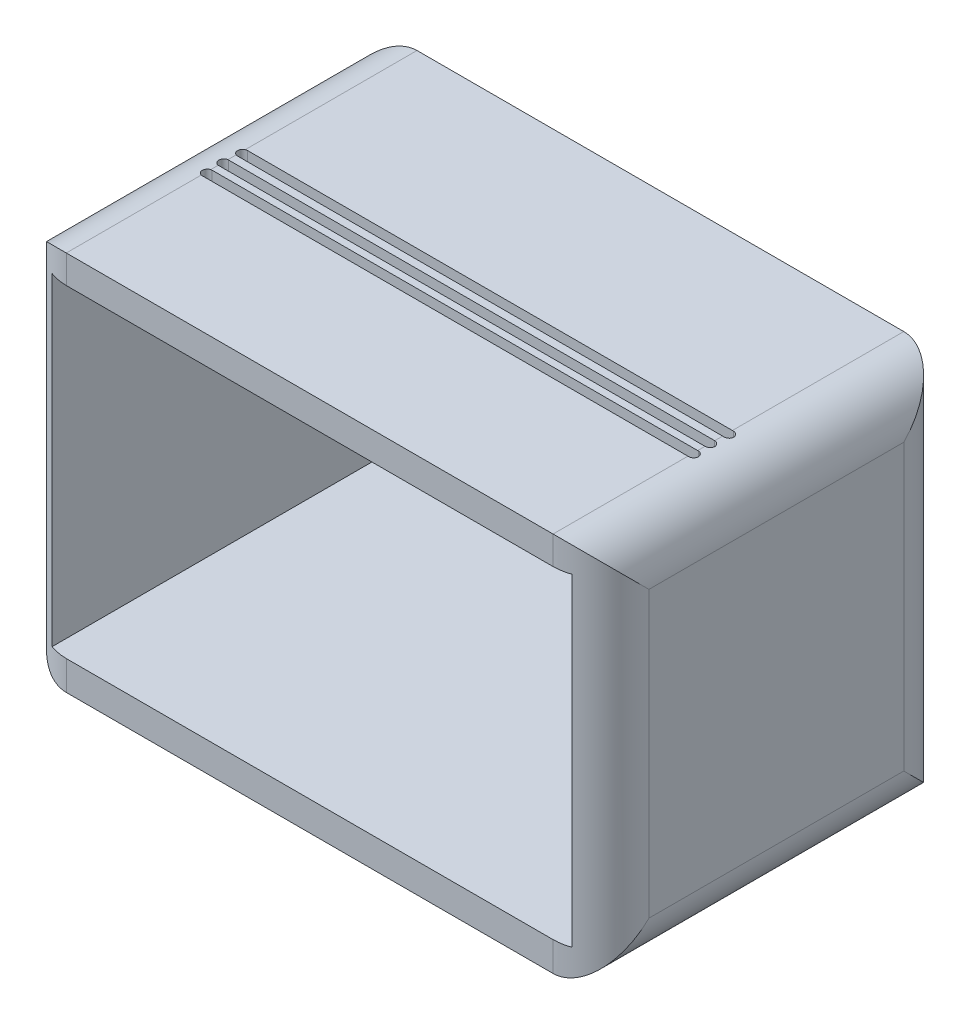
from build123d import *

# Parameters (mm, degrees)
IZIM1_W                     = 121.550964813
IZIM1_H                     = 79.400227015
IZIM1_W_2                   = 108.562656073
IZIM1_H_2                   = 67.392167991
Y_KSEKLIK_EKSTR_ZYON1_DEPTH = 73.164910278
IZIM2_W                     = 108.665778405
IZIM2_H                     = 2.839609685
Y_KSEKLIK_EKSTR_ZYON3_DEPTH = 67.31
IZIM4_W                     = 43.769026383
IZIM4_H                     = 34.779664875
KES_EKSTR_ZYON3_DEPTH       = 51.308
RADYUS1_R                   = 10
RADYUS2_R                   = 10
KES_EKSTR_ZYON6_DEPTH       = 25.4
Y_KSEKLIK_EKSTR_ZYON4_DEPTH = 4.572


with BuildPart() as part:
    # Çizim1 → Yükseklik-Ekstrüzyon1 (new body)
    with BuildSketch(Plane.XY):
        with Locations((3.983010787, 3.063280364)):
            Rectangle(IZIM1_W, IZIM1_H)
        with Locations((3.860479571, 3.185811577)):
            Rectangle(IZIM1_W_2, IZIM1_H_2, mode=Mode.SUBTRACT)
    extrude(amount=Y_KSEKLIK_EKSTR_ZYON1_DEPTH)

    # Çizim2 → Yükseklik-Ekstrüzyon3 (add)
    with BuildSketch(Plane(origin=(0, -30.510272418, 0), x_dir=(1, 0, 0), z_dir=(0, 1, 0))):
        with Locations((3.70835341, -1.557090266)):
            Rectangle(IZIM2_W, IZIM2_H)
    extrude(amount=Y_KSEKLIK_EKSTR_ZYON3_DEPTH)

    # Çizim4 → Kes-Ekstrüzyon3 (cut)
    with BuildSketch(Plane(origin=(0, 0, 0.137285424), x_dir=(-1, 0, 0), z_dir=(0, 0, -1))):
        with Locations((-2.08713858, 8.765719608)):
            Rectangle(IZIM4_W, IZIM4_H)
    extrude(amount=-KES_EKSTR_ZYON3_DEPTH, mode=Mode.SUBTRACT)

    # Radyus1
    # the kernel refuses this fillet: 10 mm, written as the material it takes off along each edge
    with BuildSketch(Plane(origin=(64.758493193, -36.636833144, -25), x_dir=(0, 1, 0), z_dir=(0, 0, 1)), Plane(origin=(64.758493193, 42.763393871, -25), x_dir=(-1, 0, 0), z_dir=(0, 0, 1))) as radyus1_piece_1:
        with BuildLine():
            CenterArc((RADYUS1_R, RADYUS1_R), RADYUS1_R, 180, 90)
            Line((0, RADYUS1_R), (0, 0))
            Line((0, 0), (RADYUS1_R, 0))
        make_face()
    extrude(amount=123.164910278, mode=Mode.SUBTRACT)
    with BuildSketch(Plane(origin=(64.758493193, 67.763393871, 73.164910278), x_dir=(0, 0, -1), z_dir=(0, -1, 0))) as radyus1_piece_2:
        with BuildLine():
            CenterArc((RADYUS1_R, -RADYUS1_R), RADYUS1_R, 90, 90)
            Line((0, -RADYUS1_R), (0, 0))
            Line((0, 0), (RADYUS1_R, 0))
        make_face()
    extrude(amount=129.400227015, mode=Mode.SUBTRACT)
    with BuildSketch(Plane(origin=(64.758493193, 67.763393871, 0), x_dir=(0, 0, 1), z_dir=(0, -1, 0))) as radyus1_piece_3:
        with BuildLine():
            CenterArc((RADYUS1_R, RADYUS1_R), RADYUS1_R, 180, 90)
            Line((0, RADYUS1_R), (0, 0))
            Line((0, 0), (RADYUS1_R, 0))
        make_face()
    extrude(amount=129.400227015, mode=Mode.SUBTRACT)

    # Radyus2
    # the kernel refuses this fillet: 10 mm, written as the material it takes off along each edge
    with BuildSketch(Plane(origin=(-56.79247162, 42.763393871, -25), x_dir=(1, 0, 0), z_dir=(0, 0, 1)), Plane(origin=(-56.79247162, -36.636833144, -25), x_dir=(0, 1, 0), z_dir=(0, 0, 1))) as radyus2_piece_1:
        with BuildLine():
            CenterArc((RADYUS2_R, -RADYUS2_R), RADYUS2_R, 90, 90)
            Line((0, -RADYUS2_R), (0, 0))
            Line((0, 0), (RADYUS2_R, 0))
        make_face()
    extrude(amount=123.164910278, mode=Mode.SUBTRACT)
    with BuildSketch(Plane(origin=(-56.79247162, -61.636833144, 73.164910278), x_dir=(1, 0, 0), z_dir=(0, 1, 0))) as radyus2_piece_2:
        with BuildLine():
            CenterArc((RADYUS2_R, RADYUS2_R), RADYUS2_R, 180, 90)
            Line((0, RADYUS2_R), (0, 0))
            Line((0, 0), (RADYUS2_R, 0))
        make_face()
    extrude(amount=129.400227015, mode=Mode.SUBTRACT)
    with BuildSketch(Plane(origin=(-56.79247162, -61.636833144, 0), x_dir=(1, 0, 0), z_dir=(0, 1, 0))) as radyus2_piece_3:
        with BuildLine():
            CenterArc((RADYUS2_R, -RADYUS2_R), RADYUS2_R, 90, 90)
            Line((0, -RADYUS2_R), (0, 0))
            Line((0, 0), (RADYUS2_R, 0))
        make_face()
    extrude(amount=129.400227015, mode=Mode.SUBTRACT)

    # Çizim5 → Kes-Ekstrüzyon6 (cut)
    with BuildSketch(Plane(origin=(0, 42.763393871, 0), x_dir=(1, 0, 0), z_dir=(0, 1, 0))):
        with BuildLine():
            Line((-46.423230595, -35.751971692), (55.012749139, -35.751971692))
            ThreePointArc((55.012749139, -35.751971692), (56.029772925, -36.768995478), (55.012749139, -37.786019263))
            Line((55.012749139, -37.786019263), (-46.423230595, -37.786019263))
            ThreePointArc((-46.423230595, -37.786019263), (-47.44025438, -36.768995478), (-46.423230595, -35.751971692))
        make_face()
        with BuildLine():
            Line((-46.550358568, -42.998266165), (54.885621166, -42.998266165))
            ThreePointArc((54.885621166, -42.998266165), (55.902644952, -44.015289951), (54.885621166, -45.032313737))
            Line((54.885621166, -45.032313737), (-46.550358568, -45.032313737))
            ThreePointArc((-46.550358568, -45.032313737), (-47.567382354, -44.015289951), (-46.550358568, -42.998266165))
        make_face()
        with BuildLine():
            Line((-46.677486541, -39.438682915), (54.758493193, -39.438682915))
            ThreePointArc((54.758493193, -39.438682915), (55.775516978, -40.455706701), (54.758493193, -41.472730487))
            Line((54.758493193, -41.472730487), (-46.677486541, -41.472730487))
            ThreePointArc((-46.677486541, -41.472730487), (-47.694510327, -40.455706701), (-46.677486541, -39.438682915))
        make_face()
    extrude(amount=-KES_EKSTR_ZYON6_DEPTH, mode=Mode.SUBTRACT)

    # Çizim6 → Yükseklik-Ekstrüzyon4 (add)
    with BuildSketch(Plane(origin=(0, -36.636833144, 0), x_dir=(-1, 0, 0), z_dir=(0, -1, 0))):
        with BuildLine():
            Line((-46.87100271, -4.227005014), (-46.87100271, -64.014742354))
            ThreePointArc((-46.87100271, -64.014742354), (-49.504404567, -66.64814421), (-52.137806423, -64.014742354))
            Line((-52.137806423, -64.014742354), (-52.137806423, -4.227005014))
            ThreePointArc((-52.137806423, -4.227005014), (-49.504404567, -1.593603158), (-46.87100271, -4.227005014))
        make_face()
        with BuildLine():
            Line((44.301980946, -4.525434052), (44.301980946, -64.313171393))
            ThreePointArc((44.301980946, -64.313171393), (41.66857909, -66.946573249), (39.035177234, -64.313171393))
            Line((39.035177234, -64.313171393), (39.035177234, -4.525434052))
            ThreePointArc((39.035177234, -4.525434052), (41.66857909, -1.892032196), (44.301980946, -4.525434052))
        make_face()
    extrude(amount=Y_KSEKLIK_EKSTR_ZYON4_DEPTH)


solid = part.part
